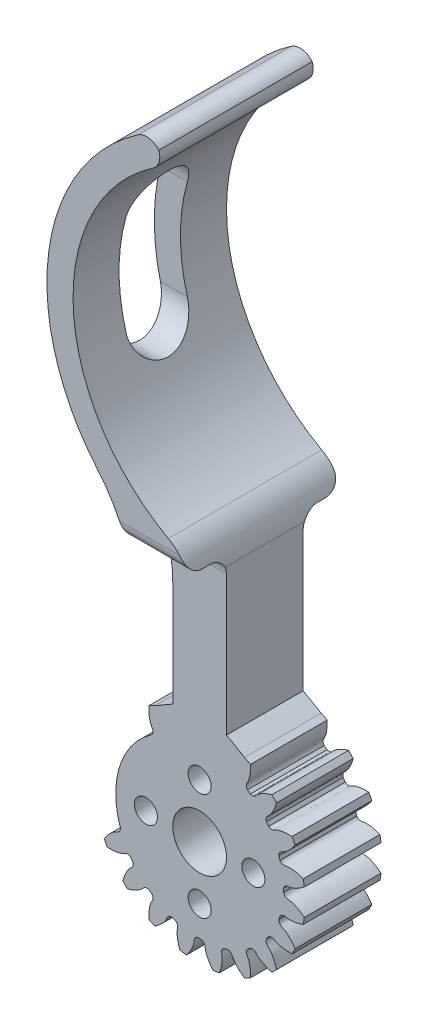
from build123d import *
from build123d.topology import SkipClean

# Parameters (mm, degrees)
SKETCH_1_R               = 13.75
EXTRUDE_1_DEPTH          = 10
CUT_EXTRUDE_1_DEPTH      = 22.866069606
PATTERN_CIRCULAR_1_COUNT = 20
EXTRUDE_2_DEPTH          = 5
EXTRUDE_2_DEPTH_BACK     = 15
CUT_EXTRUDE_3_DEPTH      = 10
CUT_EXTRUDE_3_DEPTH_BACK = 32
SKETCH_7_W               = 5
SKETCH_7_H               = 34
FILLET_2_R               = 2
SKETCH_4_R               = 3.5
SKETCH_4_R_2             = 1.5
CUT_EXTRUDE_2_DEPTH      = 20
CUT_EXTRUDE_START        = -10
CUT_EXTRUDE_5_DEPTH      = 10
FILLET_3_R               = 20
FILLET_4_R               = 5
FILLET_5_R               = 2
CUT_EXTRUDE_6_DEPTH      = 55


with BuildPart() as part:
    # 草图1 → 凸台-拉伸1 (new body)
    with BuildSketch(Plane.XY):
        Circle(SKETCH_1_R)
    extrude(amount=EXTRUDE_1_DEPTH)

    # 草图2 → 切除-拉伸1 (cut, through all)
    with BuildSketch(Plane.XY):
        with BuildLine():
            ThreePointArc((0.241645751, 10.934830295), (0, 10.9375), (-0.241645751, 10.934830295))
            add(Edge.make_bspline(
                [(-0.241645751, 10.934830295), (-0.763986756, 11.11684439), (-0.696355124, 11.483892124), (-0.766121321, 11.837511753), (-0.773615233, 11.871945767), (-0.782888612, 11.910793269), (-0.794115121, 11.953996045), (-0.807473925, 12.001489371), (-0.823140069, 12.053203535), (-0.841287339, 12.109063416), (-0.862087187, 12.168988684), (-0.885708875, 12.232893806), (-0.912319248, 12.300688126), (-0.942082628, 12.372275913), (-0.975160664, 12.447556439), (-1.011712206, 12.526424039), (-1.051893167, 12.608768189), (-1.095856396, 12.694473577), (-1.143751548, 12.783420187), (-1.195724957, 12.87548338), (-1.251919512, 12.970533976), (-1.312474533, 13.068438347), (-1.377525652, 13.169058507), (-1.447204695, 13.272252205), (-1.521639564, 13.377873025), (-1.600954126, 13.485770488), (-1.685268101, 13.595790151), (-1.774696952, 13.707773716), (-1.869351783, 13.821559139), (-1.969339231, 13.936980743), (-2.074761371, 14.053869328), (-2.185715611, 14.172052294), (-2.302294605, 14.291353753), (-2.424586158, 14.411594659), (-2.552673133, 14.532592924), (-2.686633373, 14.654163553), (-2.826539612, 14.776118764), (-2.972459398, 14.898268124), (-3.124455015, 15.020418683), (-3.282583418, 15.142375102), (-3.446896124, 15.2639398), (-3.676841988, 15.427049835), (-3.854915516, 15.545415751), (-3.976447477, 15.622814825)],
                knots=[0, 0, 0, 0, 0.165916003, 0.170905922, 0.176663519, 0.183188797, 0.190481754, 0.198542391, 0.207370708, 0.216966704, 0.22733038, 0.238461736, 0.250360771, 0.263027487, 0.276461881, 0.290663956, 0.30563371, 0.321371144, 0.337876258, 0.355149051, 0.373189524, 0.391997677, 0.411573509, 0.431917021, 0.453028213, 0.474907084, 0.497553636, 0.520967867, 0.545149777, 0.570099367, 0.595816637, 0.622301587, 0.649554216, 0.677574526, 0.706362514, 0.735918183, 0.766241531, 0.797332559, 0.829191267, 0.861817654, 0.895211721, 0.929373468, 1, 1, 1, 1], degree=3))
            ThreePointArc((-3.976447477, 15.622814825), (0, 16.120932901), (3.976447477, 15.622814825))
            add(Edge.make_bspline(
                [(0.241645751, 10.934830295), (0.763986756, 11.11684439), (0.696355124, 11.483892124), (0.766121321, 11.837511753), (0.773615233, 11.871945767), (0.782888612, 11.910793269), (0.794115121, 11.953996045), (0.807473925, 12.001489371), (0.823140069, 12.053203535), (0.841287339, 12.109063416), (0.862087187, 12.168988684), (0.885708875, 12.232893806), (0.912319248, 12.300688126), (0.942082628, 12.372275913), (0.975160664, 12.447556439), (1.011712206, 12.526424039), (1.051893167, 12.608768189), (1.095856396, 12.694473577), (1.143751548, 12.783420187), (1.195724957, 12.87548338), (1.251919512, 12.970533976), (1.312474533, 13.068438347), (1.377525652, 13.169058507), (1.447204695, 13.272252205), (1.521639564, 13.377873025), (1.600954126, 13.485770488), (1.685268101, 13.595790151), (1.774696952, 13.707773716), (1.869351783, 13.821559139), (1.969339231, 13.936980743), (2.074761371, 14.053869328), (2.185715611, 14.172052294), (2.302294605, 14.291353753), (2.424586158, 14.411594659), (2.552673133, 14.532592924), (2.686633373, 14.654163553), (2.826539612, 14.776118764), (2.972459398, 14.898268124), (3.124455015, 15.020418683), (3.282583418, 15.142375102), (3.446896124, 15.2639398), (3.676841988, 15.427049835), (3.854915516, 15.545415751), (3.976447477, 15.622814825)],
                knots=[0, 0, 0, 0, 0.165916003, 0.170905922, 0.176663519, 0.183188797, 0.190481754, 0.198542391, 0.207370708, 0.216966704, 0.22733038, 0.238461736, 0.250360771, 0.263027487, 0.276461881, 0.290663956, 0.30563371, 0.321371144, 0.337876258, 0.355149051, 0.373189524, 0.391997677, 0.411573509, 0.431917021, 0.453028213, 0.474907084, 0.497553636, 0.520967867, 0.545149777, 0.570099367, 0.595816637, 0.622301587, 0.649554216, 0.677574526, 0.706362514, 0.735918183, 0.766241531, 0.797332559, 0.829191267, 0.861817654, 0.895211721, 0.929373468, 1, 1, 1, 1], degree=3))
        make_face()
    cut_extrude_1 = extrude(amount=CUT_EXTRUDE_1_DEPTH, mode=Mode.SUBTRACT)

    # 阵列(圆周)1: 切除-拉伸1 ×20 about axis
    pattern_circular_1_axis = Axis((0, 0, -1.5), (0, 0, 1))
    for i in range(1, PATTERN_CIRCULAR_1_COUNT):
        add(cut_extrude_1.rotate(pattern_circular_1_axis, i * 360 / PATTERN_CIRCULAR_1_COUNT), mode=Mode.SUBTRACT)

    # 草图6 → 凸台-拉伸2 (add, two sides: drawn at the far end of the back side and taken through both)
    with BuildSketch(Plane(origin=(0, 0, 0), x_dir=(-1, 0, 0), z_dir=(0, 0, -1)).offset(-EXTRUDE_2_DEPTH_BACK)):
        with BuildLine():
            Line((-3.5, 0), (3.5, 0))
            Line((3.5, 0), (3.5, 10.32690032))
            Line((3.5, 10.32690032), (3.5, 13.800605072))
            Line((3.5, 13.800605072), (3.5, 35.971404539))
            ThreePointArc((3.5, 35.971404539), (14.870225343, 59.587758993), (1.202189606, 81.952888573))
            Line((1.202189606, 81.952888573), (-0.5, 79.004609691))
            ThreePointArc((-0.5, 79.004609691), (11.441891872, 56.550924332), (-3.5, 35.971404539))
            Line((-3.5, 35.971404539), (-3.5, 13.800605072))
            Line((-3.5, 13.800605072), (-3.5, 10.32690032))
            Line((-3.5, 10.32690032), (-3.5, 0))
        make_face()
        with BuildLine():
            Line((3.5, 13.800605072), (3.5, 10.32690032))
            add(Edge.make_bspline(
                [(3.5, 10.32690032), (4.156413811, 10.291875113), (4.200761863, 10.688312594), (4.393103935, 11.03302397), (4.418885843, 11.076011904), (4.458931571, 11.138710403), (4.509766902, 11.213065778), (4.58267603, 11.311112911), (4.671237054, 11.420807284), (4.776478734, 11.5410308), (4.899365137, 11.670602183), (5.040791529, 11.808280759), (5.201581362, 11.952770029), (5.38248323, 12.10272148), (5.584168076, 12.256738531), (5.744241751, 12.369149234), (5.836552423, 12.430773747), (5.853360338, 12.441891848)],
                knots=[0.482278834, 0.482278834, 0.482278834, 0.482278834, 0.658484305, 0.663474224, 0.675757099, 0.683050056, 0.69993901, 0.719898682, 0.742929074, 0.769030183, 0.798202012, 0.83044456, 0.865757826, 0.904141811, 0.945596515, 0.990121938, 1, 1, 1, 1], degree=3))
            Line((5.853360338, 12.441891848), (3.5, 13.800605072))
        make_face()
        with BuildLine():
            add(Edge.make_bspline(
                [(-3.5, 10.32690032), (-4.156413811, 10.291875113), (-4.200761863, 10.688312594), (-4.393103935, 11.03302397), (-4.418885843, 11.076011904), (-4.458931571, 11.138710403), (-4.509766902, 11.213065778), (-4.58267603, 11.311112911), (-4.671237054, 11.420807284), (-4.776478734, 11.5410308), (-4.899365137, 11.670602183), (-5.040791529, 11.808280759), (-5.201581362, 11.952770029), (-5.38248323, 12.10272148), (-5.584168076, 12.256738531), (-5.744241751, 12.369149234), (-5.836552423, 12.430773747), (-5.853360338, 12.441891848)],
                knots=[-0.010289468, -0.010289468, -0.010289468, -0.010289468, 0.165916003, 0.170905922, 0.183188797, 0.190481754, 0.207370708, 0.22733038, 0.250360771, 0.276461881, 0.30563371, 0.337876258, 0.373189524, 0.411573509, 0.453028213, 0.497553636, 0.507431698, 0.507431698, 0.507431698, 0.507431698], degree=3))
            Line((-3.5, 10.32690032), (-3.5, 13.800605072))
            Line((-3.5, 13.800605072), (-5.853360338, 12.441891848))
        make_face()
    extrude(amount=EXTRUDE_2_DEPTH + EXTRUDE_2_DEPTH_BACK)

    # 草图7 → 切除-拉伸3 (cut, two sides: drawn at the far end of the back side and taken through both)
    with SkipClean():  # the faces are left unmerged after this step: merging them gives an invalid solid
        with BuildSketch(Plane(origin=(3.5, 0, 0), x_dir=(0, 0, -1), z_dir=(1, 0, 0)).offset(-CUT_EXTRUDE_3_DEPTH_BACK)):
            with Locations((2.5, 17)):
                Rectangle(SKETCH_7_W, SKETCH_7_H)
            with Locations((-12.5, 17)):
                Rectangle(SKETCH_7_W, SKETCH_7_H)
        extrude(amount=CUT_EXTRUDE_3_DEPTH + CUT_EXTRUDE_3_DEPTH_BACK, mode=Mode.SUBTRACT)

    # 圆角2
    fillet_2_edges = [part.edges().sort_by_distance(p)[0] for p in [
        (0, 34, 10),
        (0, 34, 15),
        (0, 34, 0),
        (0, 34, -5),
    ]]
    fillet(fillet_2_edges, radius=FILLET_2_R)

    # 草图4 → 切除-拉伸2 (cut)
    with BuildSketch(Plane.XY.offset(10)):
        Circle(SKETCH_4_R)
        with Locations((0, 7)):
            Circle(SKETCH_4_R_2)
        with Locations((7, 0)):
            Circle(SKETCH_4_R_2)
        with Locations((0, -7)):
            Circle(SKETCH_4_R_2)
        with Locations((-7, 0)):
            Circle(SKETCH_4_R_2)
    extrude(amount=-CUT_EXTRUDE_2_DEPTH, mode=Mode.SUBTRACT)

    # 草图17 → 切除-拉伸5 (cut)
    with BuildSketch(Plane.XY.offset(10).offset(CUT_EXTRUDE_START)):
        with BuildLine():
            ThreePointArc((-10.324968963, -3.608867158), (-10.47431425, 3.149229626), (-6.622827503, 8.704427731))
            Line((-6.622827503, 8.704427731), (-10.596524004, 13.927084369))
            ThreePointArc((-10.596524004, 13.927084369), (-16.7589028, 5.038767402), (-16.519950341, -5.774187452))
            Line((-16.519950341, -5.774187452), (-10.324968963, -3.608867158))
        make_face()
    extrude(amount=CUT_EXTRUDE_5_DEPTH, mode=Mode.SUBTRACT)

    # 圆角3
    fillet_3_edges = [part.edges().sort_by_distance(p)[0] for p in [
        (-3.5, 35.971404539, 5),
    ]]
    fillet(fillet_3_edges, radius=FILLET_3_R)

    # 圆角4
    fillet_4_edges = [part.edges().sort_by_distance(p)[0] for p in [
        (3.5, 35.971404539, 5),
    ]]
    fillet(fillet_4_edges, radius=FILLET_4_R)

    # 圆角5
    # the kernel refuses this fillet: 2 mm, written as the material it takes off along each edge
    with BuildSketch(Plane(origin=(-1.202189606, 81.952888573, 20.397822926), x_dir=(-0.8456562247774595, -0.5337279733114377, 0), z_dir=(0, 0, -1))) as fillet_5_piece_1:
        with BuildLine():
            CenterArc((2.080341428, -1.99844752), FILLET_5_R, 87.742313242, 94.515373516)
            Line((0.081893908, -2.077235263), (0, 0))
            ThreePointArc((0, 0), (1.079564585, 0.02127237), (2.159129171, 0))
        make_face()
    extrude(amount=30.795645853, mode=Mode.SUBTRACT)
    with BuildSketch(Plane(origin=(0.5, 79.004609691, -9.807406984), x_dir=(-0.8461386341816288, -0.532962861506548, 0), z_dir=(0, 0, 1))) as fillet_5_piece_2:
        with BuildLine():
            CenterArc((1.924503012, -1.998517966), FILLET_5_R, 92.205862893, 85.588274214)
            Line((-0.074014954, -1.921537846), (0, 0))
            ThreePointArc((0, 0), (0.923761446, -0.017784406), (1.847522892, 0))
        make_face()
    extrude(amount=29.614813968, mode=Mode.SUBTRACT)

    # 草图19 → 切除-拉伸6 (cut)
    with BuildSketch(Plane(origin=(12.5, 0, 0), x_dir=(0, 0, -1), z_dir=(1, 0, 0))):
        with BuildLine():
            Line((-1, 64.72), (-1, 51.72))
            ThreePointArc((-1, 51.72), (-5, 47.72), (-9, 51.72))
            Line((-9, 51.72), (-9, 64.72))
            ThreePointArc((-9, 64.72), (-5, 68.72), (-1, 64.72))
        make_face()
    extrude(amount=-CUT_EXTRUDE_6_DEPTH, mode=Mode.SUBTRACT)


solid = part.part
